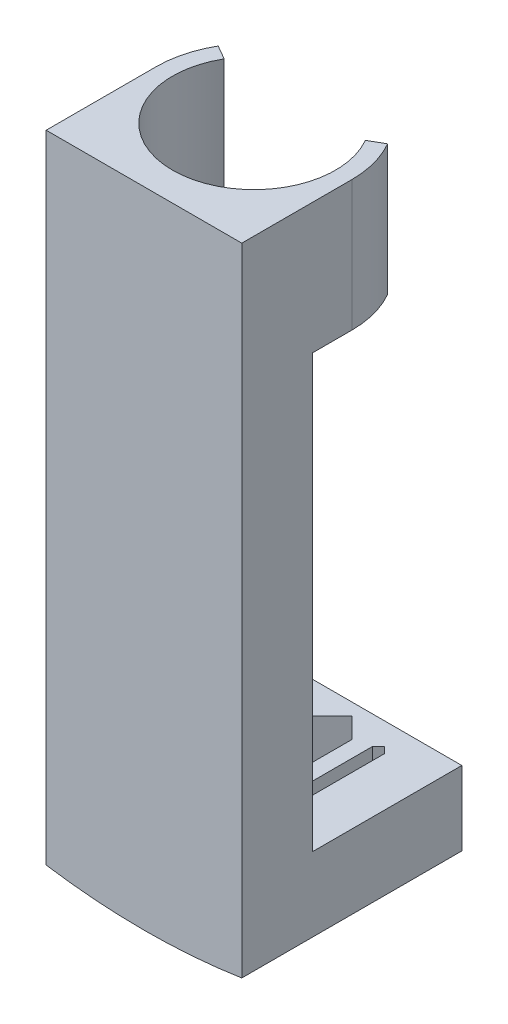
from build123d import *

# Parameters (mm, degrees)
BOSS_EXTRUDE1_DEPTH      = 56
BOSS_EXTRUDE2_DEPTH      = 16
BOSS_EXTRUDE3_DEPTH      = 3
BOSS_EXTRUDE3_DEPTH_BACK = 8
SKETCH4_W                = 24
SKETCH4_H                = 27
SKETCH5_W                = 28.405044576
SKETCH5_H                = 3.736732925


with BuildPart() as part:
    # Sketch2 → Boss-Extrude1 (new body)
    with BuildSketch(Plane(origin=(0, 0, 0), x_dir=(1, 0, 0), z_dir=(0, 1, 0))):
        with BuildLine():
            Line((12, -13.5), (-12, -13.5))
            Line((-12, -13.5), (-12, -4.795831523))
            Line((-12, -4.795831523), (-11, -4.795831523))
            ThreePointArc((-11, -4.795831523), (0, -12), (11, -4.795831523))
            Line((11, -4.795831523), (12, -4.795831523))
            Line((12, -4.795831523), (12, -13.5))
        make_face()
    extrude(amount=BOSS_EXTRUDE1_DEPTH)

    # Sketch3 → Boss-Extrude2 (add)
    with BuildSketch(Plane(origin=(0, 56, 0), x_dir=(1, 0, 0), z_dir=(0, 1, 0))):
        with BuildLine():
            Line((-12, -13.5), (12, -13.5))
            Line((12, -13.5), (12, 0))
            ThreePointArc((12, 0), (11.591109915, 3.105828541), (10.392304845, 6))
            Line((10.392304845, 6), (8.660254038, 5))
            ThreePointArc((8.660254038, 5), (0, -10), (-8.660254038, 5))
            Line((-8.660254038, 5), (-10.392304845, 6))
            ThreePointArc((-10.392304845, 6), (-11.591109915, 3.105828541), (-12, 0))
            Line((-12, 0), (-12, -13.5))
        make_face()
    extrude(amount=BOSS_EXTRUDE2_DEPTH)

    # Sketch4 → Boss-Extrude3 (add, two sides: drawn at the far end of the back side and taken through both)
    with BuildSketch(Plane(origin=(0, 0, 0), x_dir=(1, 0, 0), z_dir=(0, 1, 0)).offset(-BOSS_EXTRUDE3_DEPTH_BACK)):
        Rectangle(SKETCH4_W, SKETCH4_H)
        Polygon((0, -12), (2.5, -9.5), (2.5, 9.5), (0, 12), (-2.5, 9.5), (-2.5, -9.5), align=None, mode=Mode.SUBTRACT)
        Polygon((5.25, -10.790620927), (4.5, -10.040620927), (4.5, 10.040620927), (5.25, 10.790620927), (6, 10.040620927), (6, -10.040620927), align=None, mode=Mode.SUBTRACT)
        Polygon((-6, 10.040620927), (-6, -10.040620927), (-5.25, -10.790620927), (-4.5, -10.040620927), (-4.5, 10.040620927), (-5.25, 10.790620927), align=None, mode=Mode.SUBTRACT)
    extrude(amount=BOSS_EXTRUDE3_DEPTH + BOSS_EXTRUDE3_DEPTH_BACK)

    # Sketch5 → Cut-Revolve1 (revolve, cut)
    with BuildSketch(Plane(origin=(0, 0, 0), x_dir=(0, 0, -1), z_dir=(1, 0, 0))):
        with Locations((0.702522288, -8.868366462)):
            Rectangle(SKETCH5_W, SKETCH5_H)
    revolve(axis=Axis((0, 72, 13.5), (0, 0, -1)), mode=Mode.SUBTRACT)


solid = part.part
